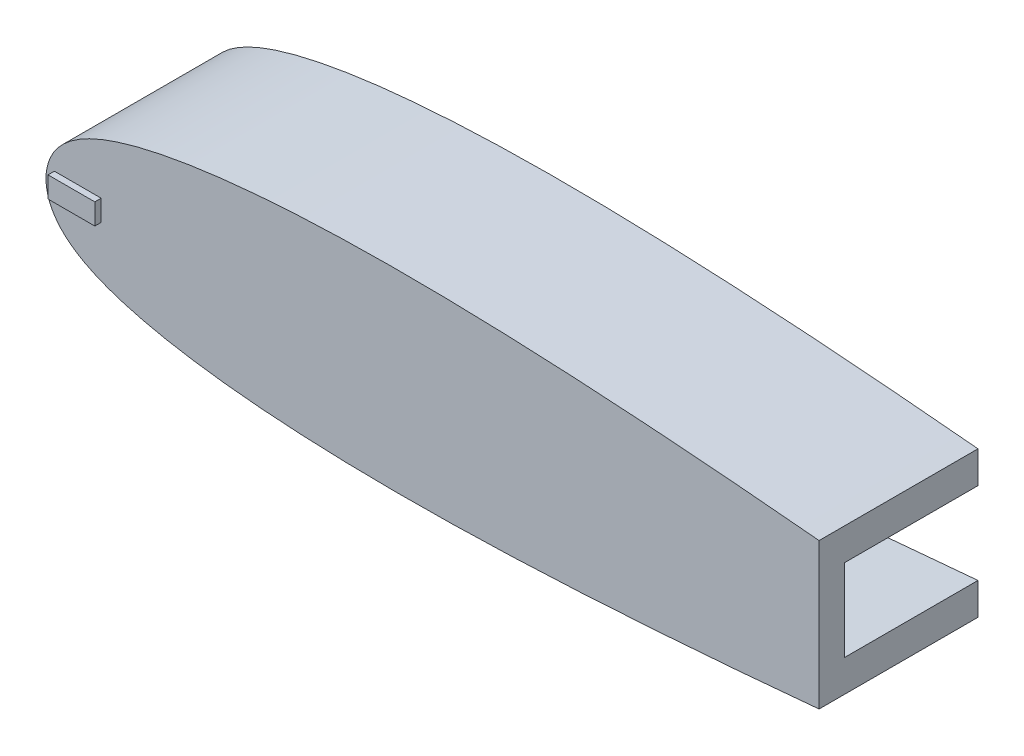
from build123d import *

# Parameters (mm, degrees)
EXTRUDE_THIN1_DEPTH     = 25
BOSS_EXTRUDE1_DEPTH     = 4
CUT_EXTRUDE2_DEPTH      = 174.184112679
CUT_EXTRUDE2_DEPTH_BACK = 174.184112679
SKETCH5_W               = 69.684795367
SKETCH5_H               = 70.10712746
SKETCH6_W               = 7.359859908
SKETCH6_H               = 3.296218478
BOSS_EXTRUDE2_DEPTH     = 1


# Read off the part's stored shape, not the designer's step: Extrude-Thin1
with BuildPart() as part:
    # Extrude-Thin1 outline → Extrude-Thin1 (new body)
    with BuildSketch(Plane.XY):
        with BuildLine():
            Line((170, 0.2142), (170.69448652, 5.165733952))
            add(Edge.make_bspline(
                [(170.69448652, 5.165733952), (170.247484606, 5.228429029), (169.796328039, 5.291455848), (168.897669003, 5.416320845), (168.448409105, 5.478438313), (167.100466371, 5.663917149), (166.201837792, 5.7864069), (163.505301027, 6.150439579), (161.707402344, 6.388528701), (156.312475173, 7.089939352), (152.714395049, 7.540300022), (141.91608293, 8.844323358), (134.711819484, 9.651575734), (120.288984664, 11.147229163), (113.07041835, 11.835767279), (98.611984798, 13.070921731), (91.372106253, 13.617965563), (76.861027939, 14.51127831), (69.58972004, 14.858624983), (58.650163362, 15.143900558), (54.997959197, 15.199244211), (47.680838227, 15.206260774), (44.01565987, 15.158294341), (36.669716058, 14.922399896), (32.98878707, 14.73536872), (27.450917316, 14.302444922), (25.602032281, 14.132493393), (21.896919766, 13.72691399), (20.040334887, 13.4915178), (16.315612404, 12.931225425), (14.447352106, 12.607134242), (11.626908362, 12.018113904), (10.683891608, 11.804418138), (8.786809891, 11.329711029), (7.833490321, 11.069106087), (5.909091427, 10.478105468), (4.939391363, 10.149286348), (3.454409263, 9.564801222), (2.955843728, 9.355045675), (2.195762386, 9.006334449), (1.940018967, 8.884134229), (1.424973863, 8.625911246), (1.166607252, 8.490475946), (0.641487272, 8.200019117), (0.375033098, 8.045020052), (-0.162843546, 7.711759116), (-0.433294971, 7.534452192), (-0.987657896, 7.142847733), (-1.270107344, 6.92925004), (-1.837811835, 6.458898082), (-2.128048112, 6.198541956), (-2.713666443, 5.606023901), (-3.006169919, 5.277842604), (-3.584697801, 4.514137272), (-3.869712582, 4.077954845), (-4.250184992, 3.334477803), (-4.369107986, 3.07194082), (-4.583834664, 2.514946461), (-4.680202253, 2.217985135), (-4.915953199, 1.296037803), (-5, 0.657628293), (-5, -0.657628293), (-4.915953199, -1.296037803), (-4.680202253, -2.217985135), (-4.583834664, -2.514946461), (-4.369107986, -3.07194082), (-4.250184992, -3.334477803), (-3.869712582, -4.077954845), (-3.584697801, -4.514137272), (-3.006169919, -5.277842604), (-2.713666443, -5.606023901), (-2.128048112, -6.198541956), (-1.837811835, -6.458898082), (-1.270107344, -6.92925004), (-0.987657896, -7.142847733), (-0.433294971, -7.534452192), (-0.162843546, -7.711759116), (0.375033098, -8.045020052), (0.641487272, -8.200019117), (1.166607252, -8.490475946), (1.424973863, -8.625911246), (1.940018967, -8.884134229), (2.195762386, -9.006334449), (2.955843728, -9.355045675), (3.454409263, -9.564801222), (4.939391363, -10.149286348), (5.909091427, -10.478105468), (7.833490321, -11.069106087), (8.786809891, -11.329711029), (10.683891608, -11.804418138), (11.626908362, -12.018113904), (14.447352106, -12.607134242), (16.315612404, -12.931225425), (20.040334887, -13.4915178), (21.896919766, -13.72691399), (25.602032281, -14.132493393), (27.450917316, -14.302444922), (32.98878707, -14.73536872), (36.669716058, -14.922399896), (44.01565987, -15.158294341), (47.680838227, -15.206260774), (54.997959197, -15.199244211), (58.650163362, -15.143900558), (69.58972004, -14.858624983), (76.861027939, -14.51127831), (91.372106253, -13.617965563), (98.611984798, -13.070921731), (113.07041835, -11.835767279), (120.288984664, -11.147229163), (134.711819484, -9.651575734), (141.916110373, -8.844318041), (152.714380974, -7.540299592), (156.312475173, -7.089939352), (161.707402344, -6.388528701), (163.505301027, -6.150439579), (166.201837792, -5.7864069), (167.100466371, -5.663917149), (168.448409105, -5.478438313), (168.897669003, -5.416320845), (169.796328039, -5.291455848), (170.247484606, -5.228429029), (170.69448652, -5.165733952)],
                knots=[0, 0, 0, 0, 0.00390625, 0.00390625, 0.0078125, 0.0078125, 0.015625, 0.015625, 0.03125, 0.03125, 0.0625, 0.0625, 0.125, 0.125, 0.1875, 0.1875, 0.25, 0.25, 0.3125, 0.3125, 0.34375, 0.34375, 0.375, 0.375, 0.40625, 0.40625, 0.421875, 0.421875, 0.4375, 0.4375, 0.453125, 0.453125, 0.4609375, 0.4609375, 0.46875, 0.46875, 0.4765625, 0.4765625, 0.48046875, 0.48046875, 0.482421875, 0.482421875, 0.484375, 0.484375, 0.486328125, 0.486328125, 0.48828125, 0.48828125, 0.490234375, 0.490234375, 0.4921875, 0.4921875, 0.494140625, 0.494140625, 0.49609375, 0.49609375, 0.497070312, 0.497070312, 0.498046875, 0.498046875, 0.5, 0.5, 0.501953125, 0.501953125, 0.502929688, 0.502929688, 0.50390625, 0.50390625, 0.505859375, 0.505859375, 0.5078125, 0.5078125, 0.509765625, 0.509765625, 0.51171875, 0.51171875, 0.513671875, 0.513671875, 0.515625, 0.515625, 0.517578125, 0.517578125, 0.51953125, 0.51953125, 0.5234375, 0.5234375, 0.53125, 0.53125, 0.5390625, 0.5390625, 0.546875, 0.546875, 0.5625, 0.5625, 0.578125, 0.578125, 0.59375, 0.59375, 0.625, 0.625, 0.65625, 0.65625, 0.6875, 0.6875, 0.75, 0.75, 0.8125, 0.8125, 0.875, 0.875, 0.9375, 0.9375, 0.96875, 0.96875, 0.984375, 0.984375, 0.9921875, 0.9921875, 0.99609375, 0.99609375, 1, 1, 1, 1], degree=3))
            Line((170.69448652, -5.165733952), (170, -0.2142))
            add(Edge.make_bspline(
                [(170, 0.2142), (169.96691342, 0.218840619), (169.834646413, 0.237391972), (169.537333236, 0.279024137), (169.042585815, 0.348138554), (168.351556262, 0.444222957), (167.465861685, 0.566675287), (166.387568835, 0.714696442), (165.119197415, 0.887397871), (163.663702113, 1.083622861), (162.024490194, 1.302244578), (160.205382022, 1.541876743), (158.210634282, 1.801225039), (156.044893294, 2.078728885), (153.713221626, 2.372926959), (150.289057759, 2.797861008), (146.662395353, 3.235863882), (142.841697446, 3.684291554), (139.769351121, 4.037499855), (136.569100778, 4.397549669), (132.068788222, 4.892266007), (127.422978073, 5.384378087), (121.375060844, 5.999625203), (116.361049701, 6.487216835), (111.246606258, 6.959992239), (107.31337029, 7.310092358), (103.328024652, 7.650341722), (99.299870496, 7.978732727), (95.238314948, 8.293055446), (91.152846167, 8.591268853), (87.053004363, 8.871082509), (82.948358141, 9.13033403), (78.848497392, 9.366803888), (74.762993375, 9.578311692), (70.701379602, 9.762701033), (66.673140916, 9.917914682), (62.687682017, 10.041902075), (58.754319968, 10.132910693), (54.882226278, 10.189181523), (51.080441726, 10.209173885), (47.357843858, 10.191610864), (43.723124833, 10.135446531), (40.184769339, 10.039770769), (36.751031834, 9.904098329), (33.429929756, 9.728148284), (30.229218443, 9.511905171), (27.156354465, 9.255709661), (24.218493071, 8.960193372), (21.422491655, 8.626124422), (18.774841867, 8.254741447), (16.281708623, 7.847260375), (13.948834696, 7.405401505), (11.781627403, 6.930718554), (9.785010864, 6.425204715), (7.96352359, 5.890657841), (6.321164006, 5.329128456), (4.861440512, 4.742481339), (3.587256905, 4.132452641), (2.500860336, 3.500441188), (1.603848063, 2.847161059), (0.897528539, 2.171977334), (0.384178046, 1.472535432), (0.070036308, 0.74578498), (-0.034140779, 0), (0.070036308, -0.74578498), (0.384178046, -1.472535432), (0.897528539, -2.171977334), (1.603848063, -2.847161059), (2.500860336, -3.500441188), (3.587256905, -4.132452641), (4.861440512, -4.742481339), (6.321164006, -5.329128456), (7.96352359, -5.890657841), (9.785010864, -6.425204715), (11.781627403, -6.930718554), (13.948834696, -7.405401505), (16.281708623, -7.847260375), (18.774841867, -8.254741447), (21.422491655, -8.626124422), (24.218493071, -8.960193372), (27.156354465, -9.255709661), (30.229218443, -9.511905171), (33.429929756, -9.728148284), (36.751031834, -9.904098329), (40.184769339, -10.039770769), (43.723124833, -10.135446531), (47.357843858, -10.191610864), (51.080441726, -10.209173885), (54.882226278, -10.189181523), (58.754319968, -10.132910693), (62.687682017, -10.041902075), (66.673140916, -9.917914682), (70.701379602, -9.762701033), (74.762993375, -9.578311692), (78.848497392, -9.366803888), (82.948358141, -9.13033403), (87.053004363, -8.871082509), (91.152846167, -8.591268853), (95.238314948, -8.293055446), (99.299870496, -7.978732727), (103.328024652, -7.650341722), (107.31337029, -7.310092358), (111.246606258, -6.959992239), (116.361049701, -6.487216835), (121.375060844, -5.999625203), (127.422978073, -5.384378087), (132.068788222, -4.892266007), (136.569100778, -4.397549669), (139.769351121, -4.037499855), (143.774710008, -3.577028977), (147.594918, -3.1243829), (151.221066258, -2.682200029), (153.713221626, -2.372926959), (156.044893294, -2.078728885), (158.210634282, -1.801225039), (160.205382022, -1.541876743), (162.024490194, -1.302244578), (163.663702113, -1.083622861), (165.119197415, -0.887397871), (166.387568835, -0.714696442), (167.465861685, -0.566675287), (168.351556262, -0.444222957), (169.042585815, -0.348138554), (169.537333236, -0.279024137), (169.834646413, -0.237391972), (169.96691342, -0.218840619), (170, -0.2142)],
                knots=[0, 0, 0, 0, 0.000289136, 0.001155852, 0.002598072, 0.004612291, 0.007193602, 0.010335843, 0.014031423, 0.018271458, 0.023045751, 0.028342883, 0.034150144, 0.040453722, 0.047238578, 0.054488567, 0.070313963, 0.078851952, 0.087780082, 0.097077365, 0.106721842, 0.126960673, 0.1375073, 0.159330995, 0.170556744, 0.181956674, 0.193504, 0.205171592, 0.216932161, 0.228757981, 0.240621468, 0.252494876, 0.264350496, 0.276160728, 0.287898242, 0.299535934, 0.311046961, 0.32240503, 0.333584247, 0.344559424, 0.355305888, 0.365799654, 0.376017641, 0.38593752, 0.395537818, 0.404798063, 0.413698789, 0.422221673, 0.430349467, 0.438066139, 0.445357153, 0.452209429, 0.458611496, 0.464554007, 0.470029929, 0.475035083, 0.479569168, 0.483636909, 0.487250212, 0.4904315, 0.49321883, 0.495674081, 0.497891233, 0.5, 0.502108767, 0.504325919, 0.50678117, 0.5095685, 0.512749788, 0.516363091, 0.520430832, 0.524964917, 0.529970071, 0.535445993, 0.541388504, 0.547790571, 0.554642847, 0.561933861, 0.569650533, 0.577778327, 0.586301211, 0.595201937, 0.604462182, 0.61406248, 0.623982359, 0.634200346, 0.644694112, 0.655440576, 0.666415753, 0.67759497, 0.688953039, 0.700464066, 0.712101758, 0.723839272, 0.735649504, 0.747505124, 0.759378532, 0.771242019, 0.783067839, 0.794828408, 0.806496, 0.818043326, 0.829443256, 0.840669005, 0.8624927, 0.873039327, 0.893278158, 0.902922635, 0.912219918, 0.921148048, 0.937813568, 0.945511433, 0.952761422, 0.959546278, 0.965849856, 0.971657117, 0.976954249, 0.981728542, 0.985968577, 0.989664157, 0.992806398, 0.995387709, 0.997401928, 0.998844148, 0.999710864, 1, 1, 1, 1], degree=3))
        make_face()
    extrude(amount=EXTRUDE_THIN1_DEPTH)

    # Sketch4 → Boss-Extrude1 (add)
    with BuildSketch(Plane.XY.offset(25)):
        with BuildLine():
            Line((170, -0.2142), (170, 0.2142))
            add(Edge.make_bspline(
                [(170, 0.2142), (169.96691342, 0.218840619), (169.834646413, 0.237391972), (169.537333236, 0.279024137), (169.042585815, 0.348138554), (168.351556262, 0.444222957), (167.465861685, 0.566675287), (166.387568835, 0.714696442), (165.119197415, 0.887397871), (163.663702113, 1.083622861), (162.024490194, 1.302244578), (160.205382022, 1.541876743), (158.210634282, 1.801225039), (156.044893294, 2.078728885), (153.713221626, 2.372926959), (150.289057759, 2.797861008), (146.662395353, 3.235863882), (142.841697446, 3.684291554), (139.769351121, 4.037499855), (136.569100778, 4.397549669), (132.068788222, 4.892266007), (127.422978073, 5.384378087), (121.375060844, 5.999625203), (116.361049701, 6.487216835), (111.246606258, 6.959992239), (107.31337029, 7.310092358), (103.328024652, 7.650341722), (99.299870496, 7.978732727), (95.238314948, 8.293055446), (91.152846167, 8.591268853), (87.053004363, 8.871082509), (82.948358141, 9.13033403), (78.848497392, 9.366803888), (74.762993375, 9.578311692), (70.701379602, 9.762701033), (66.673140916, 9.917914682), (62.687682017, 10.041902075), (58.754319968, 10.132910693), (54.882226278, 10.189181523), (51.080441726, 10.209173885), (47.357843858, 10.191610864), (43.723124833, 10.135446531), (40.184769339, 10.039770769), (36.751031834, 9.904098329), (33.429929756, 9.728148284), (30.229218443, 9.511905171), (27.156354465, 9.255709661), (24.218493071, 8.960193372), (21.422491655, 8.626124422), (18.774841867, 8.254741447), (16.281708623, 7.847260375), (13.948834696, 7.405401505), (11.781627403, 6.930718554), (9.785010864, 6.425204715), (7.96352359, 5.890657841), (6.321164006, 5.329128456), (4.861440512, 4.742481339), (3.587256905, 4.132452641), (2.500860336, 3.500441188), (1.603848063, 2.847161059), (0.897528539, 2.171977334), (0.384178046, 1.472535432), (0.070036308, 0.74578498), (-0.034140779, 0), (0.070036308, -0.74578498), (0.384178046, -1.472535432), (0.897528539, -2.171977334), (1.603848063, -2.847161059), (2.500860336, -3.500441188), (3.587256905, -4.132452641), (4.861440512, -4.742481339), (6.321164006, -5.329128456), (7.96352359, -5.890657841), (9.785010864, -6.425204715), (11.781627403, -6.930718554), (13.948834696, -7.405401505), (16.281708623, -7.847260375), (18.774841867, -8.254741447), (21.422491655, -8.626124422), (24.218493071, -8.960193372), (27.156354465, -9.255709661), (30.229218443, -9.511905171), (33.429929756, -9.728148284), (36.751031834, -9.904098329), (40.184769339, -10.039770769), (43.723124833, -10.135446531), (47.357843858, -10.191610864), (51.080441726, -10.209173885), (54.882226278, -10.189181523), (58.754319968, -10.132910693), (62.687682017, -10.041902075), (66.673140916, -9.917914682), (70.701379602, -9.762701033), (74.762993375, -9.578311692), (78.848497392, -9.366803888), (82.948358141, -9.13033403), (87.053004363, -8.871082509), (91.152846167, -8.591268853), (95.238314948, -8.293055446), (99.299870496, -7.978732727), (103.328024652, -7.650341722), (107.31337029, -7.310092358), (111.246606258, -6.959992239), (116.361049701, -6.487216835), (121.375060844, -5.999625203), (127.422978073, -5.384378087), (132.068788222, -4.892266007), (136.569100778, -4.397549669), (139.769351121, -4.037499855), (143.774710008, -3.577028977), (147.594918, -3.1243829), (151.221066258, -2.682200029), (153.713221626, -2.372926959), (156.044893294, -2.078728885), (158.210634282, -1.801225039), (160.205382022, -1.541876743), (162.024490194, -1.302244578), (163.663702113, -1.083622861), (165.119197415, -0.887397871), (166.387568835, -0.714696442), (167.465861685, -0.566675287), (168.351556262, -0.444222957), (169.042585815, -0.348138554), (169.537333236, -0.279024137), (169.834646413, -0.237391972), (169.96691342, -0.218840619), (170, -0.2142)],
                knots=[0, 0, 0, 0, 0.000289136, 0.001155852, 0.002598072, 0.004612291, 0.007193602, 0.010335843, 0.014031423, 0.018271458, 0.023045751, 0.028342883, 0.034150144, 0.040453722, 0.047238578, 0.054488567, 0.070313963, 0.078851952, 0.087780082, 0.097077365, 0.106721842, 0.126960673, 0.1375073, 0.159330995, 0.170556744, 0.181956674, 0.193504, 0.205171592, 0.216932161, 0.228757981, 0.240621468, 0.252494876, 0.264350496, 0.276160728, 0.287898242, 0.299535934, 0.311046961, 0.32240503, 0.333584247, 0.344559424, 0.355305888, 0.365799654, 0.376017641, 0.38593752, 0.395537818, 0.404798063, 0.413698789, 0.422221673, 0.430349467, 0.438066139, 0.445357153, 0.452209429, 0.458611496, 0.464554007, 0.470029929, 0.475035083, 0.479569168, 0.483636909, 0.487250212, 0.4904315, 0.49321883, 0.495674081, 0.497891233, 0.5, 0.502108767, 0.504325919, 0.50678117, 0.5095685, 0.512749788, 0.516363091, 0.520430832, 0.524964917, 0.529970071, 0.535445993, 0.541388504, 0.547790571, 0.554642847, 0.561933861, 0.569650533, 0.577778327, 0.586301211, 0.595201937, 0.604462182, 0.61406248, 0.623982359, 0.634200346, 0.644694112, 0.655440576, 0.666415753, 0.67759497, 0.688953039, 0.700464066, 0.712101758, 0.723839272, 0.735649504, 0.747505124, 0.759378532, 0.771242019, 0.783067839, 0.794828408, 0.806496, 0.818043326, 0.829443256, 0.840669005, 0.8624927, 0.873039327, 0.893278158, 0.902922635, 0.912219918, 0.921148048, 0.937813568, 0.945511433, 0.952761422, 0.959546278, 0.965849856, 0.971657117, 0.976954249, 0.981728542, 0.985968577, 0.989664157, 0.992806398, 0.995387709, 0.997401928, 0.998844148, 0.999710864, 1, 1, 1, 1], degree=3))
        make_face()
    extrude(amount=-BOSS_EXTRUDE1_DEPTH)

    # Sketch5 → Cut-Extrude2 (cut, two sides: drawn at the far end of the back side and taken through both)
    with BuildSketch(Plane.XY.offset(25).offset(-CUT_EXTRUDE2_DEPTH_BACK)):
        with Locations((151.47090601, -4.809719425)):
            Rectangle(SKETCH5_W, SKETCH5_H)
    extrude(amount=CUT_EXTRUDE2_DEPTH + CUT_EXTRUDE2_DEPTH_BACK, mode=Mode.SUBTRACT)

    # Sketch6 → Boss-Extrude2 (add)
    with BuildSketch(Plane.XY.offset(25)):
        Rectangle(SKETCH6_W, SKETCH6_H)
    extrude(amount=BOSS_EXTRUDE2_DEPTH)


solid = part.part
